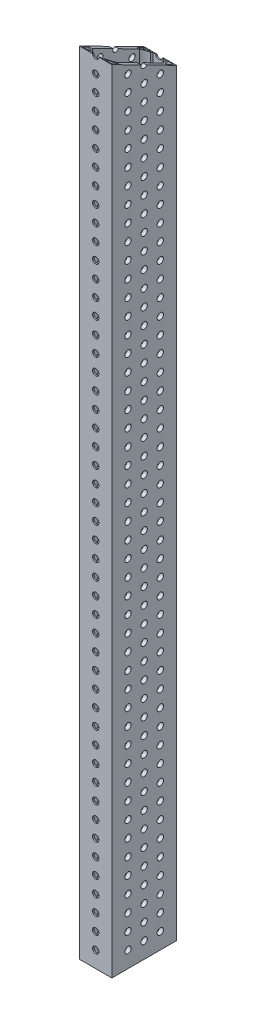
from build123d import *

# Parameters (mm, degrees)
SKETCH1_W                        = 50.8
SKETCH1_H                        = 622.3
BOSS_EXTRUDE1_DEPTH              = 25.4
CUT_EXTRUDE1_DEPTH               = 623.947622196
CUT_EXTRUDE2_DEPTH               = 623.947622196
CUT_EXTRUDE3_DEPTH               = 623.947622196
CUT_EXTRUDE4_DEPTH               = 623.947622196
CUT_EXTRUDE5_DEPTH               = 623.947622196
F_5_0_START                      = 24.384
F_5_0_5_DIAMETER_HOLE1_OUTLINE_R = 2.5
F_5_0_5_DIAMETER_HOLE1_DEPTH     = 1.016
F_5_0_5_DIAMETER_HOLE2_D         = 5
F_5_0_5_DIAMETER_HOLE2_DEPTH     = 50.8
F_5_0_START_2                    = 9.525
F_5_0_5_DIAMETER_HOLE3_OUTLINE_R = 2.5
F_5_0_5_DIAMETER_HOLE3_DEPTH     = 3.175
F_5_0_START_3                    = -12.7
F_5_0_5_DIAMETER_HOLE4_OUTLINE_R = 2.5
F_5_0_5_DIAMETER_HOLE4_DEPTH     = 3.175
FILLET1_R                        = 0.69158903
CUT_EXTRUDE6_REACH               = 625.336


# Read off the part's stored shape, not the designer's step: Ø5.0 (5) Diameter Hole1, Ø5.0 (5) Diameter Hole3, Ø5.0 (5) Diameter Hole4
with BuildPart() as part:
    # Sketch1 → Boss-Extrude1 (new body)
    with BuildSketch(Plane(origin=(12.7, 0, 0), x_dir=(0, 0, -1), z_dir=(1, 0, 0))):
        with Locations((0, 311.15)):
            Rectangle(SKETCH1_W, SKETCH1_H)
    extrude(amount=-BOSS_EXTRUDE1_DEPTH)

    # Sketch2 → Cut-Extrude1 (cut, through all)
    with BuildSketch(Plane(origin=(0, 622.3, 0), x_dir=(-1, 0, 0), z_dir=(0, 1, 0))):
        with BuildLine():
            Line((-11.684, -24.384), (-6.597089026, -24.384))
            ThreePointArc((-6.597089026, -24.384), (-5.930604499, -23.877055919), (-6.241204261, -23.09941737))
            ThreePointArc((-6.241204261, -23.09941737), (-8.576144596, -21.276144596), (-10.39941737, -18.941204261))
            ThreePointArc((-10.39941737, -18.941204261), (-11.177055919, -18.630604499), (-11.684, -19.297089026))
            Line((-11.684, -19.297089026), (-11.684, -24.384))
        make_face()
    extrude(amount=-CUT_EXTRUDE1_DEPTH, mode=Mode.SUBTRACT)

    # Sketch3 → Cut-Extrude2 (cut, through all)
    with BuildSketch(Plane(origin=(0, 622.3, 0), x_dir=(-1, 0, 0), z_dir=(0, 1, 0))):
        with BuildLine():
            Line((6.597089026, -24.384), (11.684, -24.384))
            Line((11.684, -24.384), (11.684, -19.297089026))
            ThreePointArc((11.684, -19.297089026), (11.177055919, -18.630604499), (10.39941737, -18.941204261))
            ThreePointArc((10.39941737, -18.941204261), (8.576144596, -21.276144596), (6.241204261, -23.09941737))
            ThreePointArc((6.241204261, -23.09941737), (5.930604499, -23.877055919), (6.597089026, -24.384))
        make_face()
    extrude(amount=-CUT_EXTRUDE2_DEPTH, mode=Mode.SUBTRACT)

    # Sketch4 → Cut-Extrude3 (cut, through all)
    with BuildSketch(Plane(origin=(0, 622.3, 0), x_dir=(-1, 0, 0), z_dir=(0, 1, 0))):
        with BuildLine():
            Line((-6.597089026, 24.384), (-11.684, 24.384))
            Line((-11.684, 24.384), (-11.684, 19.297089026))
            ThreePointArc((-11.684, 19.297089026), (-11.177055919, 18.630604499), (-10.39941737, 18.941204261))
            ThreePointArc((-10.39941737, 18.941204261), (-8.576144596, 21.276144596), (-6.241204261, 23.09941737))
            ThreePointArc((-6.241204261, 23.09941737), (-5.930604499, 23.877055919), (-6.597089026, 24.384))
        make_face()
    extrude(amount=-CUT_EXTRUDE3_DEPTH, mode=Mode.SUBTRACT)

    # Sketch5 → Cut-Extrude4 (cut, through all)
    with BuildSketch(Plane(origin=(0, 622.3, 0), x_dir=(-1, 0, 0), z_dir=(0, 1, 0))):
        with BuildLine():
            Line((11.684, 19.297089026), (11.684, 24.384))
            Line((11.684, 24.384), (6.597089026, 24.384))
            ThreePointArc((6.597089026, 24.384), (5.930604499, 23.877055919), (6.241204261, 23.09941737))
            ThreePointArc((6.241204261, 23.09941737), (8.576144596, 21.276144596), (10.39941737, 18.941204261))
            ThreePointArc((10.39941737, 18.941204261), (11.177055919, 18.630604499), (11.684, 19.297089026))
        make_face()
    extrude(amount=-CUT_EXTRUDE4_DEPTH, mode=Mode.SUBTRACT)

    # Sketch6 → Cut-Extrude5 (cut, through all)
    with BuildSketch(Plane.XZ):
        with BuildLine():
            Line((9.525, -18.42381265), (9.525, 18.42381265))
            ThreePointArc((9.525, 18.42381265), (7.514726072, 20.886363558), (4.8895, 22.679000251))
            Line((4.8895, 22.679000251), (4.8895, 24.384))
            Line((4.8895, 24.384), (-4.8895, 24.384))
            Line((-4.8895, 24.384), (-4.8895, 22.679000251))
            ThreePointArc((-4.8895, 22.679000251), (-7.514726072, 20.886363558), (-9.525, 18.42381265))
            Line((-9.525, 18.42381265), (-9.525, -18.42381265))
            ThreePointArc((-9.525, -18.42381265), (-7.514726072, -20.886363558), (-4.8895, -22.679000251))
            Line((-4.8895, -22.679000251), (-4.8895, -24.384))
            Line((-4.8895, -24.384), (4.8895, -24.384))
            Line((4.8895, -24.384), (4.8895, -22.679000251))
            ThreePointArc((4.8895, -22.679000251), (7.514726072, -20.886363558), (9.525, -18.42381265))
        make_face()
    extrude(amount=-CUT_EXTRUDE5_DEPTH, mode=Mode.SUBTRACT)

    # Ø5.0 (5) Diameter Hole1 outline → Ø5.0 (5) Diameter Hole1 (cut)
    with BuildSketch(Plane.XY.offset(F_5_0_START)):
        with Locations((0, 12.7)):
            Circle(F_5_0_5_DIAMETER_HOLE1_OUTLINE_R)
        with Locations((0, 25.4)):
            Circle(F_5_0_5_DIAMETER_HOLE1_OUTLINE_R)
        with Locations((0, 38.1)):
            Circle(F_5_0_5_DIAMETER_HOLE1_OUTLINE_R)
        with Locations((0, 50.8)):
            Circle(F_5_0_5_DIAMETER_HOLE1_OUTLINE_R)
        with Locations((0, 63.5)):
            Circle(F_5_0_5_DIAMETER_HOLE1_OUTLINE_R)
        with Locations((0, 76.2)):
            Circle(F_5_0_5_DIAMETER_HOLE1_OUTLINE_R)
        with Locations((0, 88.9)):
            Circle(F_5_0_5_DIAMETER_HOLE1_OUTLINE_R)
        with Locations((0, 101.6)):
            Circle(F_5_0_5_DIAMETER_HOLE1_OUTLINE_R)
        with Locations((0, 114.3)):
            Circle(F_5_0_5_DIAMETER_HOLE1_OUTLINE_R)
        with Locations((0, 127)):
            Circle(F_5_0_5_DIAMETER_HOLE1_OUTLINE_R)
        with Locations((0, 139.7)):
            Circle(F_5_0_5_DIAMETER_HOLE1_OUTLINE_R)
        with Locations((0, 152.4)):
            Circle(F_5_0_5_DIAMETER_HOLE1_OUTLINE_R)
        with Locations((0, 165.1)):
            Circle(F_5_0_5_DIAMETER_HOLE1_OUTLINE_R)
        with Locations((0, 177.8)):
            Circle(F_5_0_5_DIAMETER_HOLE1_OUTLINE_R)
        with Locations((0, 190.5)):
            Circle(F_5_0_5_DIAMETER_HOLE1_OUTLINE_R)
        with Locations((0, 203.2)):
            Circle(F_5_0_5_DIAMETER_HOLE1_OUTLINE_R)
        with Locations((0, 215.9)):
            Circle(F_5_0_5_DIAMETER_HOLE1_OUTLINE_R)
        with Locations((0, 228.6)):
            Circle(F_5_0_5_DIAMETER_HOLE1_OUTLINE_R)
        with Locations((0, 241.3)):
            Circle(F_5_0_5_DIAMETER_HOLE1_OUTLINE_R)
        with Locations((0, 254)):
            Circle(F_5_0_5_DIAMETER_HOLE1_OUTLINE_R)
        with Locations((0, 266.7)):
            Circle(F_5_0_5_DIAMETER_HOLE1_OUTLINE_R)
        with Locations((0, 279.4)):
            Circle(F_5_0_5_DIAMETER_HOLE1_OUTLINE_R)
        with Locations((0, 292.1)):
            Circle(F_5_0_5_DIAMETER_HOLE1_OUTLINE_R)
        with Locations((0, 304.8)):
            Circle(F_5_0_5_DIAMETER_HOLE1_OUTLINE_R)
        with Locations((0, 317.5)):
            Circle(F_5_0_5_DIAMETER_HOLE1_OUTLINE_R)
        with Locations((0, 330.2)):
            Circle(F_5_0_5_DIAMETER_HOLE1_OUTLINE_R)
        with Locations((0, 342.9)):
            Circle(F_5_0_5_DIAMETER_HOLE1_OUTLINE_R)
        with Locations((0, 355.6)):
            Circle(F_5_0_5_DIAMETER_HOLE1_OUTLINE_R)
        with Locations((0, 368.3)):
            Circle(F_5_0_5_DIAMETER_HOLE1_OUTLINE_R)
        with Locations((0, 381)):
            Circle(F_5_0_5_DIAMETER_HOLE1_OUTLINE_R)
        with Locations((0, 393.7)):
            Circle(F_5_0_5_DIAMETER_HOLE1_OUTLINE_R)
        with Locations((0, 406.4)):
            Circle(F_5_0_5_DIAMETER_HOLE1_OUTLINE_R)
        with Locations((0, 419.1)):
            Circle(F_5_0_5_DIAMETER_HOLE1_OUTLINE_R)
        with Locations((0, 431.8)):
            Circle(F_5_0_5_DIAMETER_HOLE1_OUTLINE_R)
        with Locations((0, 444.5)):
            Circle(F_5_0_5_DIAMETER_HOLE1_OUTLINE_R)
        with Locations((0, 457.2)):
            Circle(F_5_0_5_DIAMETER_HOLE1_OUTLINE_R)
        with Locations((0, 469.9)):
            Circle(F_5_0_5_DIAMETER_HOLE1_OUTLINE_R)
        with Locations((0, 482.6)):
            Circle(F_5_0_5_DIAMETER_HOLE1_OUTLINE_R)
        with Locations((0, 495.3)):
            Circle(F_5_0_5_DIAMETER_HOLE1_OUTLINE_R)
        with Locations((0, 508)):
            Circle(F_5_0_5_DIAMETER_HOLE1_OUTLINE_R)
        with Locations((0, 520.7)):
            Circle(F_5_0_5_DIAMETER_HOLE1_OUTLINE_R)
        with Locations((0, 533.4)):
            Circle(F_5_0_5_DIAMETER_HOLE1_OUTLINE_R)
        with Locations((0, 546.1)):
            Circle(F_5_0_5_DIAMETER_HOLE1_OUTLINE_R)
        with Locations((0, 558.8)):
            Circle(F_5_0_5_DIAMETER_HOLE1_OUTLINE_R)
        with Locations((0, 571.5)):
            Circle(F_5_0_5_DIAMETER_HOLE1_OUTLINE_R)
        with Locations((0, 584.2)):
            Circle(F_5_0_5_DIAMETER_HOLE1_OUTLINE_R)
        with Locations((0, 596.9)):
            Circle(F_5_0_5_DIAMETER_HOLE1_OUTLINE_R)
        with Locations((0, 609.6)):
            Circle(F_5_0_5_DIAMETER_HOLE1_OUTLINE_R)
        with BuildLine():
            Line((2.5, 622.3), (-2.5, 622.3))
            ThreePointArc((-2.5, 622.3), (0, 619.8), (2.5, 622.3))
        make_face()
    extrude(amount=F_5_0_5_DIAMETER_HOLE1_DEPTH, mode=Mode.SUBTRACT)

    # Ø5.0 (5) Diameter Hole2
    with Locations(Plane(origin=(0, 0, -25.4), x_dir=(-1, 0, 0), z_dir=(0, 0, -1))):
        with Locations((0, 1181.1), (0, 1168.4), (0, 1155.7), (0, 1143), (0, 1130.3), (0, 1117.6), (0, 1104.9), (0, 1092.2), (0, 1079.5), (0, 1066.8), (0, 1054.1), (0, 1041.4), (0, 1028.7), (0, 1016), (0, 1003.3), (0, 990.6), (0, 977.9), (0, 965.2), (0, 952.5), (0, 939.8), (0, 927.1), (0, 914.4), (0, 901.7), (0, 889), (0, 876.3), (0, 863.6), (0, 850.9), (0, 838.2), (0, 825.5), (0, 812.8), (0, 800.1), (0, 787.4), (0, 774.7), (0, 762), (0, 749.3), (0, 736.6), (0, 723.9), (0, 711.2), (0, 698.5), (0, 685.8), (0, 673.1), (0, 660.4), (0, 647.7), (0, 635), (0, 622.3), (0, 609.6), (0, 596.9), (0, 584.2), (0, 571.5), (0, 558.8), (0, 546.1), (0, 533.4), (0, 520.7), (0, 508), (0, 495.3), (0, 482.6), (0, 469.9), (0, 457.2), (0, 444.5), (0, 431.8), (0, 419.1), (0, 406.4), (0, 393.7), (0, 381), (0, 368.3), (0, 355.6), (0, 342.9), (0, 330.2), (0, 317.5), (0, 304.8), (0, 292.1), (0, 279.4), (0, 266.7), (0, 254), (0, 241.3), (0, 228.6), (0, 215.9), (0, 203.2), (0, 190.5), (0, 177.8), (0, 165.1), (0, 152.4), (0, 139.7), (0, 127), (0, 114.3), (0, 101.6), (0, 88.9), (0, 76.2), (0, 63.5), (0, 50.8), (0, 38.1), (0, 25.4), (0, 12.7)):
            Hole(F_5_0_5_DIAMETER_HOLE2_D / 2, depth=F_5_0_5_DIAMETER_HOLE2_DEPTH)

    # Ø5.0 (5) Diameter Hole3 outline → Ø5.0 (5) Diameter Hole3 (cut)
    with BuildSketch(Plane.YZ.offset(F_5_0_START_2)):
        with Locations((12.7, 12.7)):
            Circle(F_5_0_5_DIAMETER_HOLE3_OUTLINE_R)
        with Locations((12.7, 0)):
            Circle(F_5_0_5_DIAMETER_HOLE3_OUTLINE_R)
        with Locations((12.7, -12.7)):
            Circle(F_5_0_5_DIAMETER_HOLE3_OUTLINE_R)
        with Locations((25.4, 12.7)):
            Circle(F_5_0_5_DIAMETER_HOLE3_OUTLINE_R)
        with Locations((25.4, 0)):
            Circle(F_5_0_5_DIAMETER_HOLE3_OUTLINE_R)
        with Locations((25.4, -12.7)):
            Circle(F_5_0_5_DIAMETER_HOLE3_OUTLINE_R)
        with Locations((38.1, 12.7)):
            Circle(F_5_0_5_DIAMETER_HOLE3_OUTLINE_R)
        with Locations((38.1, 0)):
            Circle(F_5_0_5_DIAMETER_HOLE3_OUTLINE_R)
        with Locations((38.1, -12.7)):
            Circle(F_5_0_5_DIAMETER_HOLE3_OUTLINE_R)
        with Locations((50.8, 12.7)):
            Circle(F_5_0_5_DIAMETER_HOLE3_OUTLINE_R)
        with Locations((50.8, 0)):
            Circle(F_5_0_5_DIAMETER_HOLE3_OUTLINE_R)
        with Locations((50.8, -12.7)):
            Circle(F_5_0_5_DIAMETER_HOLE3_OUTLINE_R)
        with Locations((63.5, 12.7)):
            Circle(F_5_0_5_DIAMETER_HOLE3_OUTLINE_R)
        with Locations((63.5, 0)):
            Circle(F_5_0_5_DIAMETER_HOLE3_OUTLINE_R)
        with Locations((63.5, -12.7)):
            Circle(F_5_0_5_DIAMETER_HOLE3_OUTLINE_R)
        with Locations((76.2, 12.7)):
            Circle(F_5_0_5_DIAMETER_HOLE3_OUTLINE_R)
        with Locations((76.2, 0)):
            Circle(F_5_0_5_DIAMETER_HOLE3_OUTLINE_R)
        with Locations((76.2, -12.7)):
            Circle(F_5_0_5_DIAMETER_HOLE3_OUTLINE_R)
        with Locations((88.9, 12.7)):
            Circle(F_5_0_5_DIAMETER_HOLE3_OUTLINE_R)
        with Locations((88.9, 0)):
            Circle(F_5_0_5_DIAMETER_HOLE3_OUTLINE_R)
        with Locations((88.9, -12.7)):
            Circle(F_5_0_5_DIAMETER_HOLE3_OUTLINE_R)
        with Locations((101.6, 12.7)):
            Circle(F_5_0_5_DIAMETER_HOLE3_OUTLINE_R)
        with Locations((101.6, 0)):
            Circle(F_5_0_5_DIAMETER_HOLE3_OUTLINE_R)
        with Locations((101.6, -12.7)):
            Circle(F_5_0_5_DIAMETER_HOLE3_OUTLINE_R)
        with Locations((114.3, 12.7)):
            Circle(F_5_0_5_DIAMETER_HOLE3_OUTLINE_R)
        with Locations((114.3, 0)):
            Circle(F_5_0_5_DIAMETER_HOLE3_OUTLINE_R)
        with Locations((114.3, -12.7)):
            Circle(F_5_0_5_DIAMETER_HOLE3_OUTLINE_R)
        with Locations((127, 12.7)):
            Circle(F_5_0_5_DIAMETER_HOLE3_OUTLINE_R)
        with Locations((127, 0)):
            Circle(F_5_0_5_DIAMETER_HOLE3_OUTLINE_R)
        with Locations((127, -12.7)):
            Circle(F_5_0_5_DIAMETER_HOLE3_OUTLINE_R)
        with Locations((139.7, 12.7)):
            Circle(F_5_0_5_DIAMETER_HOLE3_OUTLINE_R)
        with Locations((139.7, 0)):
            Circle(F_5_0_5_DIAMETER_HOLE3_OUTLINE_R)
        with Locations((139.7, -12.7)):
            Circle(F_5_0_5_DIAMETER_HOLE3_OUTLINE_R)
        with Locations((152.4, 12.7)):
            Circle(F_5_0_5_DIAMETER_HOLE3_OUTLINE_R)
        with Locations((152.4, 0)):
            Circle(F_5_0_5_DIAMETER_HOLE3_OUTLINE_R)
        with Locations((152.4, -12.7)):
            Circle(F_5_0_5_DIAMETER_HOLE3_OUTLINE_R)
        with Locations((165.1, 12.7)):
            Circle(F_5_0_5_DIAMETER_HOLE3_OUTLINE_R)
        with Locations((165.1, 0)):
            Circle(F_5_0_5_DIAMETER_HOLE3_OUTLINE_R)
        with Locations((165.1, -12.7)):
            Circle(F_5_0_5_DIAMETER_HOLE3_OUTLINE_R)
        with Locations((177.8, 12.7)):
            Circle(F_5_0_5_DIAMETER_HOLE3_OUTLINE_R)
        with Locations((177.8, 0)):
            Circle(F_5_0_5_DIAMETER_HOLE3_OUTLINE_R)
        with Locations((177.8, -12.7)):
            Circle(F_5_0_5_DIAMETER_HOLE3_OUTLINE_R)
        with Locations((190.5, 12.7)):
            Circle(F_5_0_5_DIAMETER_HOLE3_OUTLINE_R)
        with Locations((190.5, 0)):
            Circle(F_5_0_5_DIAMETER_HOLE3_OUTLINE_R)
        with Locations((190.5, -12.7)):
            Circle(F_5_0_5_DIAMETER_HOLE3_OUTLINE_R)
        with Locations((203.2, 12.7)):
            Circle(F_5_0_5_DIAMETER_HOLE3_OUTLINE_R)
        with Locations((203.2, 0)):
            Circle(F_5_0_5_DIAMETER_HOLE3_OUTLINE_R)
        with Locations((203.2, -12.7)):
            Circle(F_5_0_5_DIAMETER_HOLE3_OUTLINE_R)
        with Locations((215.9, 12.7)):
            Circle(F_5_0_5_DIAMETER_HOLE3_OUTLINE_R)
        with Locations((215.9, 0)):
            Circle(F_5_0_5_DIAMETER_HOLE3_OUTLINE_R)
        with Locations((215.9, -12.7)):
            Circle(F_5_0_5_DIAMETER_HOLE3_OUTLINE_R)
        with Locations((228.6, 12.7)):
            Circle(F_5_0_5_DIAMETER_HOLE3_OUTLINE_R)
        with Locations((228.6, 0)):
            Circle(F_5_0_5_DIAMETER_HOLE3_OUTLINE_R)
        with Locations((228.6, -12.7)):
            Circle(F_5_0_5_DIAMETER_HOLE3_OUTLINE_R)
        with Locations((241.3, 12.7)):
            Circle(F_5_0_5_DIAMETER_HOLE3_OUTLINE_R)
        with Locations((241.3, 0)):
            Circle(F_5_0_5_DIAMETER_HOLE3_OUTLINE_R)
        with Locations((241.3, -12.7)):
            Circle(F_5_0_5_DIAMETER_HOLE3_OUTLINE_R)
        with Locations((254, 12.7)):
            Circle(F_5_0_5_DIAMETER_HOLE3_OUTLINE_R)
        with Locations((254, 0)):
            Circle(F_5_0_5_DIAMETER_HOLE3_OUTLINE_R)
        with Locations((254, -12.7)):
            Circle(F_5_0_5_DIAMETER_HOLE3_OUTLINE_R)
        with Locations((266.7, 12.7)):
            Circle(F_5_0_5_DIAMETER_HOLE3_OUTLINE_R)
        with Locations((266.7, 0)):
            Circle(F_5_0_5_DIAMETER_HOLE3_OUTLINE_R)
        with Locations((266.7, -12.7)):
            Circle(F_5_0_5_DIAMETER_HOLE3_OUTLINE_R)
        with Locations((279.4, 12.7)):
            Circle(F_5_0_5_DIAMETER_HOLE3_OUTLINE_R)
        with Locations((279.4, 0)):
            Circle(F_5_0_5_DIAMETER_HOLE3_OUTLINE_R)
        with Locations((279.4, -12.7)):
            Circle(F_5_0_5_DIAMETER_HOLE3_OUTLINE_R)
        with Locations((292.1, 12.7)):
            Circle(F_5_0_5_DIAMETER_HOLE3_OUTLINE_R)
        with Locations((292.1, 0)):
            Circle(F_5_0_5_DIAMETER_HOLE3_OUTLINE_R)
        with Locations((292.1, -12.7)):
            Circle(F_5_0_5_DIAMETER_HOLE3_OUTLINE_R)
        with Locations((304.8, 12.7)):
            Circle(F_5_0_5_DIAMETER_HOLE3_OUTLINE_R)
        with Locations((304.8, 0)):
            Circle(F_5_0_5_DIAMETER_HOLE3_OUTLINE_R)
        with Locations((304.8, -12.7)):
            Circle(F_5_0_5_DIAMETER_HOLE3_OUTLINE_R)
        with Locations((317.5, 12.7)):
            Circle(F_5_0_5_DIAMETER_HOLE3_OUTLINE_R)
        with Locations((317.5, 0)):
            Circle(F_5_0_5_DIAMETER_HOLE3_OUTLINE_R)
        with Locations((317.5, -12.7)):
            Circle(F_5_0_5_DIAMETER_HOLE3_OUTLINE_R)
        with Locations((330.2, 12.7)):
            Circle(F_5_0_5_DIAMETER_HOLE3_OUTLINE_R)
        with Locations((330.2, 0)):
            Circle(F_5_0_5_DIAMETER_HOLE3_OUTLINE_R)
        with Locations((330.2, -12.7)):
            Circle(F_5_0_5_DIAMETER_HOLE3_OUTLINE_R)
        with Locations((342.9, 12.7)):
            Circle(F_5_0_5_DIAMETER_HOLE3_OUTLINE_R)
        with Locations((342.9, 0)):
            Circle(F_5_0_5_DIAMETER_HOLE3_OUTLINE_R)
        with Locations((342.9, -12.7)):
            Circle(F_5_0_5_DIAMETER_HOLE3_OUTLINE_R)
        with Locations((355.6, 12.7)):
            Circle(F_5_0_5_DIAMETER_HOLE3_OUTLINE_R)
        with Locations((355.6, 0)):
            Circle(F_5_0_5_DIAMETER_HOLE3_OUTLINE_R)
        with Locations((355.6, -12.7)):
            Circle(F_5_0_5_DIAMETER_HOLE3_OUTLINE_R)
        with Locations((368.3, 12.7)):
            Circle(F_5_0_5_DIAMETER_HOLE3_OUTLINE_R)
        with Locations((368.3, 0)):
            Circle(F_5_0_5_DIAMETER_HOLE3_OUTLINE_R)
        with Locations((368.3, -12.7)):
            Circle(F_5_0_5_DIAMETER_HOLE3_OUTLINE_R)
        with Locations((381, 12.7)):
            Circle(F_5_0_5_DIAMETER_HOLE3_OUTLINE_R)
        with Locations((381, 0)):
            Circle(F_5_0_5_DIAMETER_HOLE3_OUTLINE_R)
        with Locations((381, -12.7)):
            Circle(F_5_0_5_DIAMETER_HOLE3_OUTLINE_R)
        with Locations((393.7, 12.7)):
            Circle(F_5_0_5_DIAMETER_HOLE3_OUTLINE_R)
        with Locations((393.7, 0)):
            Circle(F_5_0_5_DIAMETER_HOLE3_OUTLINE_R)
        with Locations((393.7, -12.7)):
            Circle(F_5_0_5_DIAMETER_HOLE3_OUTLINE_R)
        with Locations((406.4, 12.7)):
            Circle(F_5_0_5_DIAMETER_HOLE3_OUTLINE_R)
        with Locations((406.4, 0)):
            Circle(F_5_0_5_DIAMETER_HOLE3_OUTLINE_R)
        with Locations((406.4, -12.7)):
            Circle(F_5_0_5_DIAMETER_HOLE3_OUTLINE_R)
        with Locations((419.1, 12.7)):
            Circle(F_5_0_5_DIAMETER_HOLE3_OUTLINE_R)
        with Locations((419.1, 0)):
            Circle(F_5_0_5_DIAMETER_HOLE3_OUTLINE_R)
        with Locations((419.1, -12.7)):
            Circle(F_5_0_5_DIAMETER_HOLE3_OUTLINE_R)
        with Locations((431.8, 12.7)):
            Circle(F_5_0_5_DIAMETER_HOLE3_OUTLINE_R)
        with Locations((431.8, 0)):
            Circle(F_5_0_5_DIAMETER_HOLE3_OUTLINE_R)
        with Locations((431.8, -12.7)):
            Circle(F_5_0_5_DIAMETER_HOLE3_OUTLINE_R)
        with Locations((444.5, 12.7)):
            Circle(F_5_0_5_DIAMETER_HOLE3_OUTLINE_R)
        with Locations((444.5, 0)):
            Circle(F_5_0_5_DIAMETER_HOLE3_OUTLINE_R)
        with Locations((444.5, -12.7)):
            Circle(F_5_0_5_DIAMETER_HOLE3_OUTLINE_R)
        with Locations((457.2, 12.7)):
            Circle(F_5_0_5_DIAMETER_HOLE3_OUTLINE_R)
        with Locations((457.2, 0)):
            Circle(F_5_0_5_DIAMETER_HOLE3_OUTLINE_R)
        with Locations((457.2, -12.7)):
            Circle(F_5_0_5_DIAMETER_HOLE3_OUTLINE_R)
        with Locations((469.9, 12.7)):
            Circle(F_5_0_5_DIAMETER_HOLE3_OUTLINE_R)
        with Locations((469.9, 0)):
            Circle(F_5_0_5_DIAMETER_HOLE3_OUTLINE_R)
        with Locations((469.9, -12.7)):
            Circle(F_5_0_5_DIAMETER_HOLE3_OUTLINE_R)
        with Locations((482.6, 12.7)):
            Circle(F_5_0_5_DIAMETER_HOLE3_OUTLINE_R)
        with Locations((482.6, 0)):
            Circle(F_5_0_5_DIAMETER_HOLE3_OUTLINE_R)
        with Locations((482.6, -12.7)):
            Circle(F_5_0_5_DIAMETER_HOLE3_OUTLINE_R)
        with Locations((495.3, 12.7)):
            Circle(F_5_0_5_DIAMETER_HOLE3_OUTLINE_R)
        with Locations((495.3, 0)):
            Circle(F_5_0_5_DIAMETER_HOLE3_OUTLINE_R)
        with Locations((495.3, -12.7)):
            Circle(F_5_0_5_DIAMETER_HOLE3_OUTLINE_R)
        with Locations((508, 12.7)):
            Circle(F_5_0_5_DIAMETER_HOLE3_OUTLINE_R)
        with Locations((508, 0)):
            Circle(F_5_0_5_DIAMETER_HOLE3_OUTLINE_R)
        with Locations((508, -12.7)):
            Circle(F_5_0_5_DIAMETER_HOLE3_OUTLINE_R)
        with Locations((520.7, 12.7)):
            Circle(F_5_0_5_DIAMETER_HOLE3_OUTLINE_R)
        with Locations((520.7, 0)):
            Circle(F_5_0_5_DIAMETER_HOLE3_OUTLINE_R)
        with Locations((520.7, -12.7)):
            Circle(F_5_0_5_DIAMETER_HOLE3_OUTLINE_R)
        with Locations((533.4, 12.7)):
            Circle(F_5_0_5_DIAMETER_HOLE3_OUTLINE_R)
        with Locations((533.4, 0)):
            Circle(F_5_0_5_DIAMETER_HOLE3_OUTLINE_R)
        with Locations((533.4, -12.7)):
            Circle(F_5_0_5_DIAMETER_HOLE3_OUTLINE_R)
        with Locations((546.1, 12.7)):
            Circle(F_5_0_5_DIAMETER_HOLE3_OUTLINE_R)
        with Locations((546.1, 0)):
            Circle(F_5_0_5_DIAMETER_HOLE3_OUTLINE_R)
        with Locations((546.1, -12.7)):
            Circle(F_5_0_5_DIAMETER_HOLE3_OUTLINE_R)
        with Locations((558.8, 12.7)):
            Circle(F_5_0_5_DIAMETER_HOLE3_OUTLINE_R)
        with Locations((558.8, 0)):
            Circle(F_5_0_5_DIAMETER_HOLE3_OUTLINE_R)
        with Locations((558.8, -12.7)):
            Circle(F_5_0_5_DIAMETER_HOLE3_OUTLINE_R)
        with Locations((571.5, 12.7)):
            Circle(F_5_0_5_DIAMETER_HOLE3_OUTLINE_R)
        with Locations((571.5, 0)):
            Circle(F_5_0_5_DIAMETER_HOLE3_OUTLINE_R)
        with Locations((571.5, -12.7)):
            Circle(F_5_0_5_DIAMETER_HOLE3_OUTLINE_R)
        with Locations((584.2, 12.7)):
            Circle(F_5_0_5_DIAMETER_HOLE3_OUTLINE_R)
        with Locations((584.2, 0)):
            Circle(F_5_0_5_DIAMETER_HOLE3_OUTLINE_R)
        with Locations((584.2, -12.7)):
            Circle(F_5_0_5_DIAMETER_HOLE3_OUTLINE_R)
        with Locations((596.9, 12.7)):
            Circle(F_5_0_5_DIAMETER_HOLE3_OUTLINE_R)
        with Locations((596.9, 0)):
            Circle(F_5_0_5_DIAMETER_HOLE3_OUTLINE_R)
        with Locations((596.9, -12.7)):
            Circle(F_5_0_5_DIAMETER_HOLE3_OUTLINE_R)
        with Locations((609.6, 12.7)):
            Circle(F_5_0_5_DIAMETER_HOLE3_OUTLINE_R)
        with Locations((609.6, 0)):
            Circle(F_5_0_5_DIAMETER_HOLE3_OUTLINE_R)
        with Locations((609.6, -12.7)):
            Circle(F_5_0_5_DIAMETER_HOLE3_OUTLINE_R)
        with BuildLine():
            Line((622.3, 10.2), (622.3, 15.2))
            ThreePointArc((622.3, 15.2), (619.8, 12.7), (622.3, 10.2))
        make_face()
        with BuildLine():
            Line((622.3, -15.2), (622.3, -10.2))
            ThreePointArc((622.3, -10.2), (619.8, -12.7), (622.3, -15.2))
        make_face()
        with BuildLine():
            Line((622.3, -2.5), (622.3, 2.5))
            ThreePointArc((622.3, 2.5), (619.8, 0), (622.3, -2.5))
        make_face()
    extrude(amount=F_5_0_5_DIAMETER_HOLE3_DEPTH, mode=Mode.SUBTRACT)

    # Ø5.0 (5) Diameter Hole4 outline → Ø5.0 (5) Diameter Hole4 (cut)
    with BuildSketch(Plane.YZ.offset(F_5_0_START_3)):
        with Locations((12.7, 12.7)):
            Circle(F_5_0_5_DIAMETER_HOLE4_OUTLINE_R)
        with Locations((12.7, 0)):
            Circle(F_5_0_5_DIAMETER_HOLE4_OUTLINE_R)
        with Locations((12.7, -12.7)):
            Circle(F_5_0_5_DIAMETER_HOLE4_OUTLINE_R)
        with Locations((25.4, 12.7)):
            Circle(F_5_0_5_DIAMETER_HOLE4_OUTLINE_R)
        with Locations((25.4, 0)):
            Circle(F_5_0_5_DIAMETER_HOLE4_OUTLINE_R)
        with Locations((25.4, -12.7)):
            Circle(F_5_0_5_DIAMETER_HOLE4_OUTLINE_R)
        with Locations((38.1, 12.7)):
            Circle(F_5_0_5_DIAMETER_HOLE4_OUTLINE_R)
        with Locations((38.1, 0)):
            Circle(F_5_0_5_DIAMETER_HOLE4_OUTLINE_R)
        with Locations((38.1, -12.7)):
            Circle(F_5_0_5_DIAMETER_HOLE4_OUTLINE_R)
        with Locations((50.8, 12.7)):
            Circle(F_5_0_5_DIAMETER_HOLE4_OUTLINE_R)
        with Locations((50.8, 0)):
            Circle(F_5_0_5_DIAMETER_HOLE4_OUTLINE_R)
        with Locations((50.8, -12.7)):
            Circle(F_5_0_5_DIAMETER_HOLE4_OUTLINE_R)
        with Locations((63.5, 12.7)):
            Circle(F_5_0_5_DIAMETER_HOLE4_OUTLINE_R)
        with Locations((63.5, 0)):
            Circle(F_5_0_5_DIAMETER_HOLE4_OUTLINE_R)
        with Locations((63.5, -12.7)):
            Circle(F_5_0_5_DIAMETER_HOLE4_OUTLINE_R)
        with Locations((76.2, 12.7)):
            Circle(F_5_0_5_DIAMETER_HOLE4_OUTLINE_R)
        with Locations((76.2, 0)):
            Circle(F_5_0_5_DIAMETER_HOLE4_OUTLINE_R)
        with Locations((76.2, -12.7)):
            Circle(F_5_0_5_DIAMETER_HOLE4_OUTLINE_R)
        with Locations((88.9, 12.7)):
            Circle(F_5_0_5_DIAMETER_HOLE4_OUTLINE_R)
        with Locations((88.9, 0)):
            Circle(F_5_0_5_DIAMETER_HOLE4_OUTLINE_R)
        with Locations((88.9, -12.7)):
            Circle(F_5_0_5_DIAMETER_HOLE4_OUTLINE_R)
        with Locations((101.6, 12.7)):
            Circle(F_5_0_5_DIAMETER_HOLE4_OUTLINE_R)
        with Locations((101.6, 0)):
            Circle(F_5_0_5_DIAMETER_HOLE4_OUTLINE_R)
        with Locations((101.6, -12.7)):
            Circle(F_5_0_5_DIAMETER_HOLE4_OUTLINE_R)
        with Locations((114.3, 12.7)):
            Circle(F_5_0_5_DIAMETER_HOLE4_OUTLINE_R)
        with Locations((114.3, 0)):
            Circle(F_5_0_5_DIAMETER_HOLE4_OUTLINE_R)
        with Locations((114.3, -12.7)):
            Circle(F_5_0_5_DIAMETER_HOLE4_OUTLINE_R)
        with Locations((127, 12.7)):
            Circle(F_5_0_5_DIAMETER_HOLE4_OUTLINE_R)
        with Locations((127, 0)):
            Circle(F_5_0_5_DIAMETER_HOLE4_OUTLINE_R)
        with Locations((127, -12.7)):
            Circle(F_5_0_5_DIAMETER_HOLE4_OUTLINE_R)
        with Locations((139.7, 12.7)):
            Circle(F_5_0_5_DIAMETER_HOLE4_OUTLINE_R)
        with Locations((139.7, 0)):
            Circle(F_5_0_5_DIAMETER_HOLE4_OUTLINE_R)
        with Locations((139.7, -12.7)):
            Circle(F_5_0_5_DIAMETER_HOLE4_OUTLINE_R)
        with Locations((152.4, 12.7)):
            Circle(F_5_0_5_DIAMETER_HOLE4_OUTLINE_R)
        with Locations((152.4, 0)):
            Circle(F_5_0_5_DIAMETER_HOLE4_OUTLINE_R)
        with Locations((152.4, -12.7)):
            Circle(F_5_0_5_DIAMETER_HOLE4_OUTLINE_R)
        with Locations((165.1, 12.7)):
            Circle(F_5_0_5_DIAMETER_HOLE4_OUTLINE_R)
        with Locations((165.1, 0)):
            Circle(F_5_0_5_DIAMETER_HOLE4_OUTLINE_R)
        with Locations((165.1, -12.7)):
            Circle(F_5_0_5_DIAMETER_HOLE4_OUTLINE_R)
        with Locations((177.8, 12.7)):
            Circle(F_5_0_5_DIAMETER_HOLE4_OUTLINE_R)
        with Locations((177.8, 0)):
            Circle(F_5_0_5_DIAMETER_HOLE4_OUTLINE_R)
        with Locations((177.8, -12.7)):
            Circle(F_5_0_5_DIAMETER_HOLE4_OUTLINE_R)
        with Locations((190.5, 12.7)):
            Circle(F_5_0_5_DIAMETER_HOLE4_OUTLINE_R)
        with Locations((190.5, 0)):
            Circle(F_5_0_5_DIAMETER_HOLE4_OUTLINE_R)
        with Locations((190.5, -12.7)):
            Circle(F_5_0_5_DIAMETER_HOLE4_OUTLINE_R)
        with Locations((203.2, 12.7)):
            Circle(F_5_0_5_DIAMETER_HOLE4_OUTLINE_R)
        with Locations((203.2, 0)):
            Circle(F_5_0_5_DIAMETER_HOLE4_OUTLINE_R)
        with Locations((203.2, -12.7)):
            Circle(F_5_0_5_DIAMETER_HOLE4_OUTLINE_R)
        with Locations((215.9, 12.7)):
            Circle(F_5_0_5_DIAMETER_HOLE4_OUTLINE_R)
        with Locations((215.9, 0)):
            Circle(F_5_0_5_DIAMETER_HOLE4_OUTLINE_R)
        with Locations((215.9, -12.7)):
            Circle(F_5_0_5_DIAMETER_HOLE4_OUTLINE_R)
        with Locations((228.6, 12.7)):
            Circle(F_5_0_5_DIAMETER_HOLE4_OUTLINE_R)
        with Locations((228.6, 0)):
            Circle(F_5_0_5_DIAMETER_HOLE4_OUTLINE_R)
        with Locations((228.6, -12.7)):
            Circle(F_5_0_5_DIAMETER_HOLE4_OUTLINE_R)
        with Locations((241.3, 12.7)):
            Circle(F_5_0_5_DIAMETER_HOLE4_OUTLINE_R)
        with Locations((241.3, 0)):
            Circle(F_5_0_5_DIAMETER_HOLE4_OUTLINE_R)
        with Locations((241.3, -12.7)):
            Circle(F_5_0_5_DIAMETER_HOLE4_OUTLINE_R)
        with Locations((254, 12.7)):
            Circle(F_5_0_5_DIAMETER_HOLE4_OUTLINE_R)
        with Locations((254, 0)):
            Circle(F_5_0_5_DIAMETER_HOLE4_OUTLINE_R)
        with Locations((254, -12.7)):
            Circle(F_5_0_5_DIAMETER_HOLE4_OUTLINE_R)
        with Locations((266.7, 12.7)):
            Circle(F_5_0_5_DIAMETER_HOLE4_OUTLINE_R)
        with Locations((266.7, 0)):
            Circle(F_5_0_5_DIAMETER_HOLE4_OUTLINE_R)
        with Locations((266.7, -12.7)):
            Circle(F_5_0_5_DIAMETER_HOLE4_OUTLINE_R)
        with Locations((279.4, 12.7)):
            Circle(F_5_0_5_DIAMETER_HOLE4_OUTLINE_R)
        with Locations((279.4, 0)):
            Circle(F_5_0_5_DIAMETER_HOLE4_OUTLINE_R)
        with Locations((279.4, -12.7)):
            Circle(F_5_0_5_DIAMETER_HOLE4_OUTLINE_R)
        with Locations((292.1, 12.7)):
            Circle(F_5_0_5_DIAMETER_HOLE4_OUTLINE_R)
        with Locations((292.1, 0)):
            Circle(F_5_0_5_DIAMETER_HOLE4_OUTLINE_R)
        with Locations((292.1, -12.7)):
            Circle(F_5_0_5_DIAMETER_HOLE4_OUTLINE_R)
        with Locations((304.8, 12.7)):
            Circle(F_5_0_5_DIAMETER_HOLE4_OUTLINE_R)
        with Locations((304.8, 0)):
            Circle(F_5_0_5_DIAMETER_HOLE4_OUTLINE_R)
        with Locations((304.8, -12.7)):
            Circle(F_5_0_5_DIAMETER_HOLE4_OUTLINE_R)
        with Locations((317.5, 12.7)):
            Circle(F_5_0_5_DIAMETER_HOLE4_OUTLINE_R)
        with Locations((317.5, 0)):
            Circle(F_5_0_5_DIAMETER_HOLE4_OUTLINE_R)
        with Locations((317.5, -12.7)):
            Circle(F_5_0_5_DIAMETER_HOLE4_OUTLINE_R)
        with Locations((330.2, 12.7)):
            Circle(F_5_0_5_DIAMETER_HOLE4_OUTLINE_R)
        with Locations((330.2, 0)):
            Circle(F_5_0_5_DIAMETER_HOLE4_OUTLINE_R)
        with Locations((330.2, -12.7)):
            Circle(F_5_0_5_DIAMETER_HOLE4_OUTLINE_R)
        with Locations((342.9, 12.7)):
            Circle(F_5_0_5_DIAMETER_HOLE4_OUTLINE_R)
        with Locations((342.9, 0)):
            Circle(F_5_0_5_DIAMETER_HOLE4_OUTLINE_R)
        with Locations((342.9, -12.7)):
            Circle(F_5_0_5_DIAMETER_HOLE4_OUTLINE_R)
        with Locations((355.6, 12.7)):
            Circle(F_5_0_5_DIAMETER_HOLE4_OUTLINE_R)
        with Locations((355.6, 0)):
            Circle(F_5_0_5_DIAMETER_HOLE4_OUTLINE_R)
        with Locations((355.6, -12.7)):
            Circle(F_5_0_5_DIAMETER_HOLE4_OUTLINE_R)
        with Locations((368.3, 12.7)):
            Circle(F_5_0_5_DIAMETER_HOLE4_OUTLINE_R)
        with Locations((368.3, 0)):
            Circle(F_5_0_5_DIAMETER_HOLE4_OUTLINE_R)
        with Locations((368.3, -12.7)):
            Circle(F_5_0_5_DIAMETER_HOLE4_OUTLINE_R)
        with Locations((381, 12.7)):
            Circle(F_5_0_5_DIAMETER_HOLE4_OUTLINE_R)
        with Locations((381, 0)):
            Circle(F_5_0_5_DIAMETER_HOLE4_OUTLINE_R)
        with Locations((381, -12.7)):
            Circle(F_5_0_5_DIAMETER_HOLE4_OUTLINE_R)
        with Locations((393.7, 12.7)):
            Circle(F_5_0_5_DIAMETER_HOLE4_OUTLINE_R)
        with Locations((393.7, 0)):
            Circle(F_5_0_5_DIAMETER_HOLE4_OUTLINE_R)
        with Locations((393.7, -12.7)):
            Circle(F_5_0_5_DIAMETER_HOLE4_OUTLINE_R)
        with Locations((406.4, 12.7)):
            Circle(F_5_0_5_DIAMETER_HOLE4_OUTLINE_R)
        with Locations((406.4, 0)):
            Circle(F_5_0_5_DIAMETER_HOLE4_OUTLINE_R)
        with Locations((406.4, -12.7)):
            Circle(F_5_0_5_DIAMETER_HOLE4_OUTLINE_R)
        with Locations((419.1, 12.7)):
            Circle(F_5_0_5_DIAMETER_HOLE4_OUTLINE_R)
        with Locations((419.1, 0)):
            Circle(F_5_0_5_DIAMETER_HOLE4_OUTLINE_R)
        with Locations((419.1, -12.7)):
            Circle(F_5_0_5_DIAMETER_HOLE4_OUTLINE_R)
        with Locations((431.8, 12.7)):
            Circle(F_5_0_5_DIAMETER_HOLE4_OUTLINE_R)
        with Locations((431.8, 0)):
            Circle(F_5_0_5_DIAMETER_HOLE4_OUTLINE_R)
        with Locations((431.8, -12.7)):
            Circle(F_5_0_5_DIAMETER_HOLE4_OUTLINE_R)
        with Locations((444.5, 12.7)):
            Circle(F_5_0_5_DIAMETER_HOLE4_OUTLINE_R)
        with Locations((444.5, 0)):
            Circle(F_5_0_5_DIAMETER_HOLE4_OUTLINE_R)
        with Locations((444.5, -12.7)):
            Circle(F_5_0_5_DIAMETER_HOLE4_OUTLINE_R)
        with Locations((457.2, 12.7)):
            Circle(F_5_0_5_DIAMETER_HOLE4_OUTLINE_R)
        with Locations((457.2, 0)):
            Circle(F_5_0_5_DIAMETER_HOLE4_OUTLINE_R)
        with Locations((457.2, -12.7)):
            Circle(F_5_0_5_DIAMETER_HOLE4_OUTLINE_R)
        with Locations((469.9, 12.7)):
            Circle(F_5_0_5_DIAMETER_HOLE4_OUTLINE_R)
        with Locations((469.9, 0)):
            Circle(F_5_0_5_DIAMETER_HOLE4_OUTLINE_R)
        with Locations((469.9, -12.7)):
            Circle(F_5_0_5_DIAMETER_HOLE4_OUTLINE_R)
        with Locations((482.6, 12.7)):
            Circle(F_5_0_5_DIAMETER_HOLE4_OUTLINE_R)
        with Locations((482.6, 0)):
            Circle(F_5_0_5_DIAMETER_HOLE4_OUTLINE_R)
        with Locations((482.6, -12.7)):
            Circle(F_5_0_5_DIAMETER_HOLE4_OUTLINE_R)
        with Locations((495.3, 12.7)):
            Circle(F_5_0_5_DIAMETER_HOLE4_OUTLINE_R)
        with Locations((495.3, 0)):
            Circle(F_5_0_5_DIAMETER_HOLE4_OUTLINE_R)
        with Locations((495.3, -12.7)):
            Circle(F_5_0_5_DIAMETER_HOLE4_OUTLINE_R)
        with Locations((508, 12.7)):
            Circle(F_5_0_5_DIAMETER_HOLE4_OUTLINE_R)
        with Locations((508, 0)):
            Circle(F_5_0_5_DIAMETER_HOLE4_OUTLINE_R)
        with Locations((508, -12.7)):
            Circle(F_5_0_5_DIAMETER_HOLE4_OUTLINE_R)
        with Locations((520.7, 12.7)):
            Circle(F_5_0_5_DIAMETER_HOLE4_OUTLINE_R)
        with Locations((520.7, 0)):
            Circle(F_5_0_5_DIAMETER_HOLE4_OUTLINE_R)
        with Locations((520.7, -12.7)):
            Circle(F_5_0_5_DIAMETER_HOLE4_OUTLINE_R)
        with Locations((533.4, 12.7)):
            Circle(F_5_0_5_DIAMETER_HOLE4_OUTLINE_R)
        with Locations((533.4, 0)):
            Circle(F_5_0_5_DIAMETER_HOLE4_OUTLINE_R)
        with Locations((533.4, -12.7)):
            Circle(F_5_0_5_DIAMETER_HOLE4_OUTLINE_R)
        with Locations((546.1, 12.7)):
            Circle(F_5_0_5_DIAMETER_HOLE4_OUTLINE_R)
        with Locations((546.1, 0)):
            Circle(F_5_0_5_DIAMETER_HOLE4_OUTLINE_R)
        with Locations((546.1, -12.7)):
            Circle(F_5_0_5_DIAMETER_HOLE4_OUTLINE_R)
        with Locations((558.8, 12.7)):
            Circle(F_5_0_5_DIAMETER_HOLE4_OUTLINE_R)
        with Locations((558.8, 0)):
            Circle(F_5_0_5_DIAMETER_HOLE4_OUTLINE_R)
        with Locations((558.8, -12.7)):
            Circle(F_5_0_5_DIAMETER_HOLE4_OUTLINE_R)
        with Locations((571.5, 12.7)):
            Circle(F_5_0_5_DIAMETER_HOLE4_OUTLINE_R)
        with Locations((571.5, 0)):
            Circle(F_5_0_5_DIAMETER_HOLE4_OUTLINE_R)
        with Locations((571.5, -12.7)):
            Circle(F_5_0_5_DIAMETER_HOLE4_OUTLINE_R)
        with Locations((584.2, 12.7)):
            Circle(F_5_0_5_DIAMETER_HOLE4_OUTLINE_R)
        with Locations((584.2, 0)):
            Circle(F_5_0_5_DIAMETER_HOLE4_OUTLINE_R)
        with Locations((584.2, -12.7)):
            Circle(F_5_0_5_DIAMETER_HOLE4_OUTLINE_R)
        with Locations((596.9, 12.7)):
            Circle(F_5_0_5_DIAMETER_HOLE4_OUTLINE_R)
        with Locations((596.9, 0)):
            Circle(F_5_0_5_DIAMETER_HOLE4_OUTLINE_R)
        with Locations((596.9, -12.7)):
            Circle(F_5_0_5_DIAMETER_HOLE4_OUTLINE_R)
        with Locations((609.6, 12.7)):
            Circle(F_5_0_5_DIAMETER_HOLE4_OUTLINE_R)
        with Locations((609.6, 0)):
            Circle(F_5_0_5_DIAMETER_HOLE4_OUTLINE_R)
        with Locations((609.6, -12.7)):
            Circle(F_5_0_5_DIAMETER_HOLE4_OUTLINE_R)
        with BuildLine():
            Line((622.3, 10.2), (622.3, 15.2))
            ThreePointArc((622.3, 15.2), (619.8, 12.7), (622.3, 10.2))
        make_face()
        with BuildLine():
            Line((622.3, -15.2), (622.3, -10.2))
            ThreePointArc((622.3, -10.2), (619.8, -12.7), (622.3, -15.2))
        make_face()
        with BuildLine():
            Line((622.3, -2.5), (622.3, 2.5))
            ThreePointArc((622.3, 2.5), (619.8, 0), (622.3, -2.5))
        make_face()
    extrude(amount=F_5_0_5_DIAMETER_HOLE4_DEPTH, mode=Mode.SUBTRACT)

    # Fillet1
    fillet1_edges = [part.edges().sort_by_distance(p)[0] for p in [
        (11.684, 311.15, -24.384),
        (-11.684, 311.15, -24.384),
        (11.684, 311.15, 24.384),
        (-11.684, 311.15, 24.384),
    ]]
    fillet(fillet1_edges, radius=FILLET1_R)

    # Cut-Extrude6: up to this face of the body (flat: up to its plane)
    cut_extrude6_end = Plane(part.part.faces().sort_by_distance((-12.7, 310.832400595, 0))[0])
    # Sketch15 → Cut-Extrude6 (cut, up to the picked face)
    with BuildSketch(Plane(origin=(12.7, 0, 0), x_dir=(0, 0, -1), z_dir=(1, 0, 0)), mode=Mode.PRIVATE) as cut_extrude6_sk1:
        Polygon((-25.4, 622.3), (25.4, 596.416107166), (25.4, 622.3), align=None)
    cut_extrude6_tool1 = split(extrude(cut_extrude6_sk1.sketch, amount=-CUT_EXTRUDE6_REACH, mode=Mode.PRIVATE), bisect_by=cut_extrude6_end, keep=Keep.BOTH, mode=Mode.PRIVATE)
    add(cut_extrude6_tool1.solids().sort_by(Axis((12.7, 613.672036, -8.466667), (-1, 0, 0)))[0], mode=Mode.SUBTRACT)


solid = part.part
